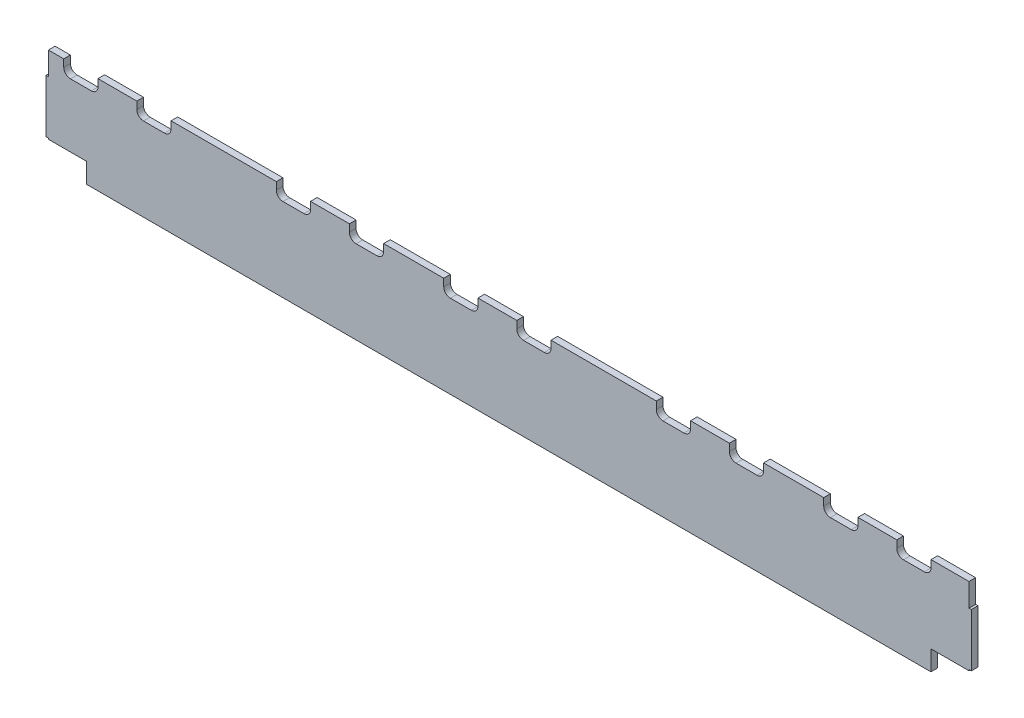
from build123d import *

# Parameters (mm, degrees)
BOSS_EXTRUDE1_DEPTH = 3.175


with BuildPart() as part:
    # Sketch2 → Boss-Extrude1 (new body)
    with BuildSketch(Plane.XY):
        with BuildLine():
            Line((-166.376823509, -157.21600002), (-166.376823509, -167.12200002))
            Line((-166.376823509, -167.12200002), (-166.376823509, -168.26500002))
            Line((-166.376823509, -168.26500002), (-167.519823509, -168.26500002))
            Line((-167.519823509, -168.26500002), (-167.519823509, -193.66500002))
            Line((-167.519823509, -193.66500002), (-166.376823509, -193.66500002))
            Line((-166.376823509, -193.66500002), (-166.376823509, -194.18100002))
            Line((-166.376823509, -194.18100002), (-148.199823509, -194.18100002))
            Line((-148.199823509, -194.18100002), (-148.199823509, -203.71400002))
            Line((-148.199823509, -203.71400002), (255.426176451, -203.71400002))
            Line((255.426176451, -203.71400002), (255.426176451, -194.18100002))
            Line((255.426176451, -194.18100002), (273.603176451, -194.18100002))
            Line((273.603176451, -194.18100002), (273.603176451, -193.66500002))
            Line((273.603176451, -193.66500002), (274.746176451, -193.66500002))
            Line((274.746176451, -193.66500002), (274.746176451, -168.26500002))
            Line((274.746176451, -168.26500002), (273.603176451, -168.26500002))
            Line((273.603176451, -168.26500002), (273.603176451, -167.12200002))
            Line((273.603176451, -167.12200002), (273.603176451, -157.21600002))
            Line((273.603176451, -157.21600002), (255.463301471, -157.21600002))
            Line((255.463301471, -157.21600002), (255.463301471, -160.70800002))
            ThreePointArc((255.463301471, -160.70800002), (254.533365501, -162.95306405), (252.288301471, -163.88300002))
            Line((252.288301471, -163.88300002), (242.288301471, -163.88300002))
            ThreePointArc((242.288301471, -163.88300002), (240.04323744, -162.95306405), (239.113301471, -160.70800002))
            Line((239.113301471, -160.70800002), (239.113301471, -157.21600002))
            Line((239.113301471, -157.21600002), (220.538301471, -157.21600002))
            Line((220.538301471, -157.21600002), (220.538301471, -160.70800002))
            ThreePointArc((220.538301471, -160.70800002), (219.608365501, -162.95306405), (217.363301471, -163.88300002))
            Line((217.363301471, -163.88300002), (207.363301471, -163.88300002))
            ThreePointArc((207.363301471, -163.88300002), (205.11823744, -162.95306405), (204.188301471, -160.70800002))
            Line((204.188301471, -160.70800002), (204.188301471, -157.21600002))
            Line((204.188301471, -157.21600002), (175.452051471, -157.21600002))
            Line((175.452051471, -157.21600002), (175.452051471, -160.70800002))
            ThreePointArc((175.452051471, -160.70800002), (174.522115501, -162.95306405), (172.277051471, -163.88300002))
            Line((172.277051471, -163.88300002), (162.277051471, -163.88300002))
            ThreePointArc((162.277051471, -163.88300002), (160.03198744, -162.95306405), (159.102051471, -160.70800002))
            Line((159.102051471, -160.70800002), (159.102051471, -157.21600002))
            Line((159.102051471, -157.21600002), (140.527051471, -157.21600002))
            Line((140.527051471, -157.21600002), (140.527051471, -160.70800002))
            ThreePointArc((140.527051471, -160.70800002), (139.597115501, -162.95306405), (137.352051471, -163.88300002))
            Line((137.352051471, -163.88300002), (127.352051471, -163.88300002))
            ThreePointArc((127.352051471, -163.88300002), (125.10698744, -162.95306405), (124.177051471, -160.70800002))
            Line((124.177051471, -160.70800002), (124.177051471, -157.21600002))
            Line((124.177051471, -157.21600002), (73.849301471, -157.21600002))
            Line((73.849301471, -157.21600002), (73.849301471, -160.70800002))
            ThreePointArc((73.849301471, -160.70800002), (72.919365501, -162.95306405), (70.674301471, -163.88300002))
            Line((70.674301471, -163.88300002), (60.674301471, -163.88300002))
            ThreePointArc((60.674301471, -163.88300002), (58.42923744, -162.95306405), (57.499301471, -160.70800002))
            Line((57.499301471, -160.70800002), (57.499301471, -157.21600002))
            Line((57.499301471, -157.21600002), (38.924301471, -157.21600002))
            Line((38.924301471, -157.21600002), (38.924301471, -160.70800002))
            ThreePointArc((38.924301471, -160.70800002), (37.994365501, -162.95306405), (35.749301471, -163.88300002))
            Line((35.749301471, -163.88300002), (25.749301471, -163.88300002))
            ThreePointArc((25.749301471, -163.88300002), (23.50423744, -162.95306405), (22.574301471, -160.70800002))
            Line((22.574301471, -160.70800002), (22.574301471, -157.21600002))
            Line((22.574301471, -157.21600002), (-6.161948529, -157.21600002))
            Line((-6.161948529, -157.21600002), (-6.161948529, -160.70800002))
            ThreePointArc((-6.161948529, -160.70800002), (-7.091884499, -162.95306405), (-9.336948529, -163.88300002))
            Line((-9.336948529, -163.88300002), (-19.336948529, -163.88300002))
            ThreePointArc((-19.336948529, -163.88300002), (-21.58201256, -162.95306405), (-22.511948529, -160.70800002))
            Line((-22.511948529, -160.70800002), (-22.511948529, -157.21600002))
            Line((-22.511948529, -157.21600002), (-41.086948529, -157.21600002))
            Line((-41.086948529, -157.21600002), (-41.086948529, -160.70800002))
            ThreePointArc((-41.086948529, -160.70800002), (-42.016884499, -162.95306405), (-44.261948529, -163.88300002))
            Line((-44.261948529, -163.88300002), (-54.261948529, -163.88300002))
            ThreePointArc((-54.261948529, -163.88300002), (-56.50701256, -162.95306405), (-57.436948529, -160.70800002))
            Line((-57.436948529, -160.70800002), (-57.436948529, -157.21600002))
            Line((-57.436948529, -157.21600002), (-107.764698529, -157.21600002))
            Line((-107.764698529, -157.21600002), (-107.764698529, -160.70800002))
            ThreePointArc((-107.764698529, -160.70800002), (-108.694634499, -162.95306405), (-110.939698529, -163.88300002))
            Line((-110.939698529, -163.88300002), (-120.939698529, -163.88300002))
            ThreePointArc((-120.939698529, -163.88300002), (-123.18476256, -162.95306405), (-124.114698529, -160.70800002))
            Line((-124.114698529, -160.70800002), (-124.114698529, -157.21600002))
            Line((-124.114698529, -157.21600002), (-142.689698529, -157.21600002))
            Line((-142.689698529, -157.21600002), (-142.689698529, -160.70800002))
            ThreePointArc((-142.689698529, -160.70800002), (-143.619634499, -162.95306405), (-145.864698529, -163.88300002))
            Line((-145.864698529, -163.88300002), (-155.864698529, -163.88300002))
            ThreePointArc((-155.864698529, -163.88300002), (-158.10976256, -162.95306405), (-159.039698529, -160.70800002))
            Line((-159.039698529, -160.70800002), (-159.039698529, -157.21600002))
            Line((-159.039698529, -157.21600002), (-166.376823509, -157.21600002))
        make_face()
    extrude(amount=BOSS_EXTRUDE1_DEPTH)


solid = part.part
